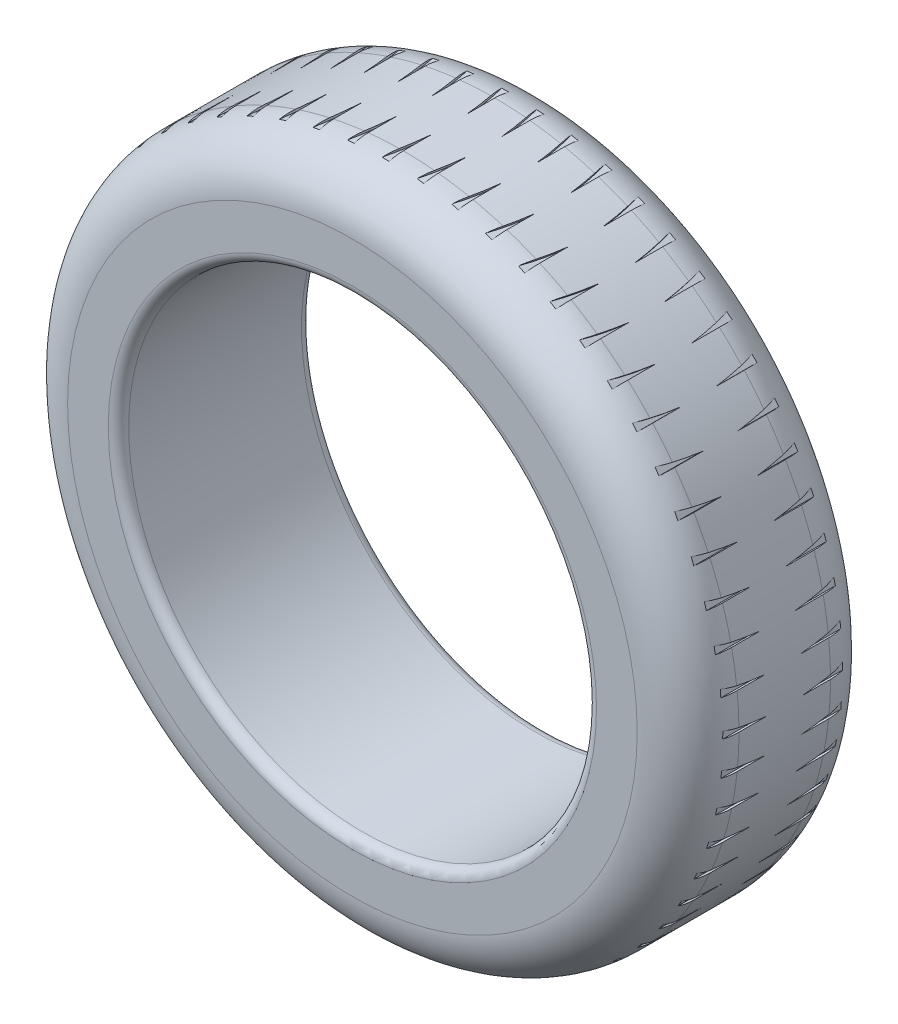
from build123d import *

# Parameters (mm, degrees)
SKETCH1_R             = 330
SKETCH1_R_2           = 230
BOSS_EXTRUDE1_DEPTH   = 190
FILLET4_R             = 50
CUT_EXTRUDE1_DEPTH    = 12
CIRPATTERN1_COUNT     = 60
MIRROR1_COPY_1_DEPTH  = 12
MIRROR1_COPY_2_DEPTH  = 12
MIRROR1_COPY_3_DEPTH  = 12
MIRROR1_COPY_4_DEPTH  = 12
MIRROR1_COPY_5_DEPTH  = 12
MIRROR1_COPY_6_DEPTH  = 12
MIRROR1_COPY_7_DEPTH  = 12
MIRROR1_COPY_8_DEPTH  = 12
MIRROR1_COPY_9_DEPTH  = 12
MIRROR1_COPY_10_DEPTH = 12
MIRROR1_COPY_11_DEPTH = 12
MIRROR1_COPY_12_DEPTH = 12
MIRROR1_COPY_13_DEPTH = 12
MIRROR1_COPY_14_DEPTH = 12
MIRROR1_COPY_15_DEPTH = 12
MIRROR1_COPY_16_DEPTH = 12
MIRROR1_COPY_17_DEPTH = 12
MIRROR1_COPY_18_DEPTH = 12
MIRROR1_COPY_19_DEPTH = 12
MIRROR1_COPY_20_DEPTH = 12
MIRROR1_COPY_21_DEPTH = 12
MIRROR1_COPY_22_DEPTH = 12
MIRROR1_COPY_23_DEPTH = 12
MIRROR1_COPY_24_DEPTH = 12
MIRROR1_COPY_25_DEPTH = 12
MIRROR1_COPY_26_DEPTH = 12
MIRROR1_COPY_27_DEPTH = 12
MIRROR1_COPY_28_DEPTH = 12
MIRROR1_COPY_29_DEPTH = 12
MIRROR1_COPY_30_DEPTH = 12
MIRROR1_COPY_31_DEPTH = 12
MIRROR1_COPY_32_DEPTH = 12
MIRROR1_COPY_33_DEPTH = 12
MIRROR1_COPY_34_DEPTH = 12
MIRROR1_COPY_35_DEPTH = 12
MIRROR1_COPY_36_DEPTH = 12
MIRROR1_COPY_37_DEPTH = 12
MIRROR1_COPY_38_DEPTH = 12
MIRROR1_COPY_39_DEPTH = 12
MIRROR1_COPY_40_DEPTH = 12
MIRROR1_COPY_41_DEPTH = 12
MIRROR1_COPY_42_DEPTH = 12
MIRROR1_COPY_43_DEPTH = 12
MIRROR1_COPY_44_DEPTH = 12
MIRROR1_COPY_45_DEPTH = 12
MIRROR1_COPY_46_DEPTH = 12
MIRROR1_COPY_47_DEPTH = 12
MIRROR1_COPY_48_DEPTH = 12
MIRROR1_COPY_49_DEPTH = 12
MIRROR1_COPY_50_DEPTH = 12
MIRROR1_COPY_51_DEPTH = 12
MIRROR1_COPY_52_DEPTH = 12
MIRROR1_COPY_53_DEPTH = 12
MIRROR1_COPY_54_DEPTH = 12
MIRROR1_COPY_55_DEPTH = 12
MIRROR1_COPY_56_DEPTH = 12
MIRROR1_COPY_57_DEPTH = 12
MIRROR1_COPY_58_DEPTH = 12
MIRROR1_COPY_59_DEPTH = 12
MIRROR1_COPY_60_DEPTH = 12
FILLET5_R             = 10


with BuildPart() as part:
    # Sketch1 → Boss-Extrude1 (new body)
    with BuildSketch(Plane.XY):
        Circle(SKETCH1_R)
        Circle(SKETCH1_R_2, mode=Mode.SUBTRACT)
    extrude(amount=-BOSS_EXTRUDE1_DEPTH)

    # Fillet4
    fillet4_edges = [part.edges().sort_by_distance(p)[0] for p in [
        (-330, 0, -190),
        (-330, 0, 0),
    ]]
    fillet(fillet4_edges, radius=FILLET4_R)

    # Sketch2 → Cut-Extrude1 (cut)
    with BuildSketch(Plane(origin=(0, 340, 0), x_dir=(1, 0, 0), z_dir=(0, 1, 0))):
        with BuildLine():
            Line((0, 77.679953819), (0, 0))
            Line((0, 0), (-10, 0))
            Line((-10, 0), (-10, 25))
            add(Edge.make_bspline(
                [(0, 77.679953819), (-1.474003448, 64.192682688), (-3.599070113, 46.669220615), (-10, 25)],
                knots=[0, 0, 0, 0, 1, 1, 1, 1], degree=3))
        make_face()
    cut_extrude1 = extrude(amount=-CUT_EXTRUDE1_DEPTH, mode=Mode.SUBTRACT)

    # CirPattern1: Cut-Extrude1 ×60 about axis
    cirpattern1_axis = Axis((0, 0, 0), (0, 0, 1))
    for i in range(1, CIRPATTERN1_COUNT):
        add(cut_extrude1.rotate(cirpattern1_axis, i * 360 / CIRPATTERN1_COUNT), mode=Mode.SUBTRACT)

    # Mirror1 copy 1 sketch → Mirror1 copy 1 (cut)
    with BuildSketch(Plane(origin=(-35.539677511, 338.137444425, -190), x_dir=(0.9945218953682733, 0.10452846326765347, 0), z_dir=(-0.10452846326765347, 0.9945218953682733, 0))):
        with BuildLine():
            Line((0, -77.679953819), (0, 0))
            Line((0, 0), (-10, 0))
            Line((-10, 0), (-10, -25))
            add(Edge.make_bspline(
                [(0, -77.679953819), (-1.474003448, -64.192682688), (-3.599070113, -46.669220615), (-10, -25)],
                knots=[0, 0, 0, 0, 1, 1, 1, 1], degree=3))
        make_face()
    extrude(amount=-MIRROR1_COPY_1_DEPTH, mode=Mode.SUBTRACT)

    # Mirror1 copy 2 sketch → Mirror1 copy 2 (cut)
    with BuildSketch(Plane(origin=(-70.689974878, 332.570184249, -190), x_dir=(0.9781476007338057, 0.20791169081775934, 0), z_dir=(-0.20791169081775934, 0.9781476007338057, 0))):
        with BuildLine():
            Line((0, -77.679953819), (0, 0))
            Line((0, 0), (-10, 0))
            Line((-10, 0), (-10, -25))
            add(Edge.make_bspline(
                [(0, -77.679953819), (-1.474003448, -64.192682688), (-3.599070113, -46.669220615), (-10, -25)],
                knots=[0, 0, 0, 0, 1, 1, 1, 1], degree=3))
        make_face()
    extrude(amount=-MIRROR1_COPY_2_DEPTH, mode=Mode.SUBTRACT)

    # Mirror1 copy 3 sketch → Mirror1 copy 3 (cut)
    with BuildSketch(Plane(origin=(-105.065778087, 323.35921554, -190), x_dir=(0.9510565162951535, 0.3090169943749474, 0), z_dir=(-0.3090169943749474, 0.9510565162951535, 0))):
        with BuildLine():
            Line((0, -77.679953819), (0, 0))
            Line((0, 0), (-10, 0))
            Line((-10, 0), (-10, -25))
            add(Edge.make_bspline(
                [(0, -77.679953819), (-1.474003448, -64.192682688), (-3.599070113, -46.669220615), (-10, -25)],
                knots=[0, 0, 0, 0, 1, 1, 1, 1], degree=3))
        make_face()
    extrude(amount=-MIRROR1_COPY_3_DEPTH, mode=Mode.SUBTRACT)

    # Mirror1 copy 4 sketch → Mirror1 copy 4 (cut)
    with BuildSketch(Plane(origin=(-138.290458646, 310.605455598, -190), x_dir=(0.9135454576426009, 0.4067366430758002, 0), z_dir=(-0.4067366430758002, 0.9135454576426009, 0))):
        with BuildLine():
            Line((0, -77.679953819), (0, 0))
            Line((0, 0), (-10, 0))
            Line((-10, 0), (-10, -25))
            add(Edge.make_bspline(
                [(0, -77.679953819), (-1.474003448, -64.192682688), (-3.599070113, -46.669220615), (-10, -25)],
                knots=[0, 0, 0, 0, 1, 1, 1, 1], degree=3))
        make_face()
    extrude(amount=-MIRROR1_COPY_4_DEPTH, mode=Mode.SUBTRACT)

    # Mirror1 copy 5 sketch → Mirror1 copy 5 (cut)
    with BuildSketch(Plane(origin=(-170, 294.448637287, -190), x_dir=(0.8660254037844387, 0.49999999999999994, 0), z_dir=(-0.49999999999999994, 0.8660254037844387, 0))):
        with BuildLine():
            Line((0, -77.679953819), (0, 0))
            Line((0, 0), (-10, 0))
            Line((-10, 0), (-10, -25))
            add(Edge.make_bspline(
                [(0, -77.679953819), (-1.474003448, -64.192682688), (-3.599070113, -46.669220615), (-10, -25)],
                knots=[0, 0, 0, 0, 1, 1, 1, 1], degree=3))
        make_face()
    extrude(amount=-MIRROR1_COPY_5_DEPTH, mode=Mode.SUBTRACT)

    # Mirror1 copy 6 sketch → Mirror1 copy 6 (cut)
    with BuildSketch(Plane(origin=(-199.846985779, 275.065778087, -190), x_dir=(0.8090169943749475, 0.5877852522924731, 0), z_dir=(-0.5877852522924731, 0.8090169943749475, 0))):
        with BuildLine():
            Line((0, -77.679953819), (0, 0))
            Line((0, 0), (-10, 0))
            Line((-10, 0), (-10, -25))
            add(Edge.make_bspline(
                [(0, -77.679953819), (-1.474003448, -64.192682688), (-3.599070113, -46.669220615), (-10, -25)],
                knots=[0, 0, 0, 0, 1, 1, 1, 1], degree=3))
        make_face()
    extrude(amount=-MIRROR1_COPY_6_DEPTH, mode=Mode.SUBTRACT)

    # Mirror1 copy 7 sketch → Mirror1 copy 7 (cut)
    with BuildSketch(Plane(origin=(-227.504406162, 252.669240662, -190), x_dir=(0.7431448254773942, 0.6691306063588582, 0), z_dir=(-0.6691306063588582, 0.7431448254773942, 0))):
        with BuildLine():
            Line((0, -77.679953819), (0, 0))
            Line((0, 0), (-10, 0))
            Line((-10, 0), (-10, -25))
            add(Edge.make_bspline(
                [(0, -77.679953819), (-1.474003448, -64.192682688), (-3.599070113, -46.669220615), (-10, -25)],
                knots=[0, 0, 0, 0, 1, 1, 1, 1], degree=3))
        make_face()
    extrude(amount=-MIRROR1_COPY_7_DEPTH, mode=Mode.SUBTRACT)

    # Mirror1 copy 8 sketch → Mirror1 copy 8 (cut)
    with BuildSketch(Plane(origin=(-252.669240662, 227.504406162, -190), x_dir=(0.6691306063588582, 0.7431448254773942, 0), z_dir=(-0.7431448254773942, 0.6691306063588582, 0))):
        with BuildLine():
            Line((0, -77.679953819), (0, 0))
            Line((0, 0), (-10, 0))
            Line((-10, 0), (-10, -25))
            add(Edge.make_bspline(
                [(0, -77.679953819), (-1.474003448, -64.192682688), (-3.599070113, -46.669220615), (-10, -25)],
                knots=[0, 0, 0, 0, 1, 1, 1, 1], degree=3))
        make_face()
    extrude(amount=-MIRROR1_COPY_8_DEPTH, mode=Mode.SUBTRACT)

    # Mirror1 copy 9 sketch → Mirror1 copy 9 (cut)
    with BuildSketch(Plane(origin=(-275.065778087, 199.846985779, -190), x_dir=(0.5877852522924731, 0.8090169943749475, 0), z_dir=(-0.8090169943749475, 0.5877852522924731, 0))):
        with BuildLine():
            Line((0, -77.679953819), (0, 0))
            Line((0, 0), (-10, 0))
            Line((-10, 0), (-10, -25))
            add(Edge.make_bspline(
                [(0, -77.679953819), (-1.474003448, -64.192682688), (-3.599070113, -46.669220615), (-10, -25)],
                knots=[0, 0, 0, 0, 1, 1, 1, 1], degree=3))
        make_face()
    extrude(amount=-MIRROR1_COPY_9_DEPTH, mode=Mode.SUBTRACT)

    # Mirror1 copy 10 sketch → Mirror1 copy 10 (cut)
    with BuildSketch(Plane(origin=(-294.448637287, 170, -190), x_dir=(0.5000000000000001, 0.8660254037844386, 0), z_dir=(-0.8660254037844386, 0.5000000000000001, 0))):
        with BuildLine():
            Line((0, -77.679953819), (0, 0))
            Line((0, 0), (-10, 0))
            Line((-10, 0), (-10, -25))
            add(Edge.make_bspline(
                [(0, -77.679953819), (-1.474003448, -64.192682688), (-3.599070113, -46.669220615), (-10, -25)],
                knots=[0, 0, 0, 0, 1, 1, 1, 1], degree=3))
        make_face()
    extrude(amount=-MIRROR1_COPY_10_DEPTH, mode=Mode.SUBTRACT)

    # Mirror1 copy 11 sketch → Mirror1 copy 11 (cut)
    with BuildSketch(Plane(origin=(-310.605455598, 138.290458646, -190), x_dir=(0.4067366430758002, 0.9135454576426009, 0), z_dir=(-0.9135454576426009, 0.4067366430758002, 0))):
        with BuildLine():
            Line((0, -77.679953819), (0, 0))
            Line((0, 0), (-10, 0))
            Line((-10, 0), (-10, -25))
            add(Edge.make_bspline(
                [(0, -77.679953819), (-1.474003448, -64.192682688), (-3.599070113, -46.669220615), (-10, -25)],
                knots=[0, 0, 0, 0, 1, 1, 1, 1], degree=3))
        make_face()
    extrude(amount=-MIRROR1_COPY_11_DEPTH, mode=Mode.SUBTRACT)

    # Mirror1 copy 12 sketch → Mirror1 copy 12 (cut)
    with BuildSketch(Plane(origin=(-323.35921554, 105.065778087, -190), x_dir=(0.30901699437494745, 0.9510565162951535, 0), z_dir=(-0.9510565162951535, 0.30901699437494745, 0))):
        with BuildLine():
            Line((0, -77.679953819), (0, 0))
            Line((0, 0), (-10, 0))
            Line((-10, 0), (-10, -25))
            add(Edge.make_bspline(
                [(0, -77.679953819), (-1.474003448, -64.192682688), (-3.599070113, -46.669220615), (-10, -25)],
                knots=[0, 0, 0, 0, 1, 1, 1, 1], degree=3))
        make_face()
    extrude(amount=-MIRROR1_COPY_12_DEPTH, mode=Mode.SUBTRACT)

    # Mirror1 copy 13 sketch → Mirror1 copy 13 (cut)
    with BuildSketch(Plane(origin=(-332.570184249, 70.689974878, -190), x_dir=(0.20791169081775945, 0.9781476007338056, 0), z_dir=(-0.9781476007338056, 0.20791169081775945, 0))):
        with BuildLine():
            Line((0, -77.679953819), (0, 0))
            Line((0, 0), (-10, 0))
            Line((-10, 0), (-10, -25))
            add(Edge.make_bspline(
                [(0, -77.679953819), (-1.474003448, -64.192682688), (-3.599070113, -46.669220615), (-10, -25)],
                knots=[0, 0, 0, 0, 1, 1, 1, 1], degree=3))
        make_face()
    extrude(amount=-MIRROR1_COPY_13_DEPTH, mode=Mode.SUBTRACT)

    # Mirror1 copy 14 sketch → Mirror1 copy 14 (cut)
    with BuildSketch(Plane(origin=(-338.137444425, 35.539677511, -190), x_dir=(0.10452846326765346, 0.9945218953682733, 0), z_dir=(-0.9945218953682733, 0.10452846326765346, 0))):
        with BuildLine():
            Line((0, -77.679953819), (0, 0))
            Line((0, 0), (-10, 0))
            Line((-10, 0), (-10, -25))
            add(Edge.make_bspline(
                [(0, -77.679953819), (-1.474003448, -64.192682688), (-3.599070113, -46.669220615), (-10, -25)],
                knots=[0, 0, 0, 0, 1, 1, 1, 1], degree=3))
        make_face()
    extrude(amount=-MIRROR1_COPY_14_DEPTH, mode=Mode.SUBTRACT)

    # Mirror1 copy 15 sketch → Mirror1 copy 15 (cut)
    with BuildSketch(Plane(origin=(-340, 0, -190), x_dir=(0, 1, 0), z_dir=(-1, 0, 0))):
        with BuildLine():
            Line((0, -77.679953819), (0, 0))
            Line((0, 0), (-10, 0))
            Line((-10, 0), (-10, -25))
            add(Edge.make_bspline(
                [(0, -77.679953819), (-1.474003448, -64.192682688), (-3.599070113, -46.669220615), (-10, -25)],
                knots=[0, 0, 0, 0, 1, 1, 1, 1], degree=3))
        make_face()
    extrude(amount=-MIRROR1_COPY_15_DEPTH, mode=Mode.SUBTRACT)

    # Mirror1 copy 16 sketch → Mirror1 copy 16 (cut)
    with BuildSketch(Plane(origin=(-338.137444425, -35.539677511, -190), x_dir=(-0.10452846326765355, 0.9945218953682733, 0), z_dir=(-0.9945218953682733, -0.10452846326765355, 0))):
        with BuildLine():
            Line((0, -77.679953819), (0, 0))
            Line((0, 0), (-10, 0))
            Line((-10, 0), (-10, -25))
            add(Edge.make_bspline(
                [(0, -77.679953819), (-1.474003448, -64.192682688), (-3.599070113, -46.669220615), (-10, -25)],
                knots=[0, 0, 0, 0, 1, 1, 1, 1], degree=3))
        make_face()
    extrude(amount=-MIRROR1_COPY_16_DEPTH, mode=Mode.SUBTRACT)

    # Mirror1 copy 17 sketch → Mirror1 copy 17 (cut)
    with BuildSketch(Plane(origin=(-332.570184249, -70.689974878, -190), x_dir=(-0.20791169081775934, 0.9781476007338057, 0), z_dir=(-0.9781476007338057, -0.20791169081775934, 0))):
        with BuildLine():
            Line((0, -77.679953819), (0, 0))
            Line((0, 0), (-10, 0))
            Line((-10, 0), (-10, -25))
            add(Edge.make_bspline(
                [(0, -77.679953819), (-1.474003448, -64.192682688), (-3.599070113, -46.669220615), (-10, -25)],
                knots=[0, 0, 0, 0, 1, 1, 1, 1], degree=3))
        make_face()
    extrude(amount=-MIRROR1_COPY_17_DEPTH, mode=Mode.SUBTRACT)

    # Mirror1 copy 18 sketch → Mirror1 copy 18 (cut)
    with BuildSketch(Plane(origin=(-323.35921554, -105.065778087, -190), x_dir=(-0.30901699437494734, 0.9510565162951536, 0), z_dir=(-0.9510565162951536, -0.30901699437494734, 0))):
        with BuildLine():
            Line((0, -77.679953819), (0, 0))
            Line((0, 0), (-10, 0))
            Line((-10, 0), (-10, -25))
            add(Edge.make_bspline(
                [(0, -77.679953819), (-1.474003448, -64.192682688), (-3.599070113, -46.669220615), (-10, -25)],
                knots=[0, 0, 0, 0, 1, 1, 1, 1], degree=3))
        make_face()
    extrude(amount=-MIRROR1_COPY_18_DEPTH, mode=Mode.SUBTRACT)

    # Mirror1 copy 19 sketch → Mirror1 copy 19 (cut)
    with BuildSketch(Plane(origin=(-310.605455598, -138.290458646, -190), x_dir=(-0.40673664307580026, 0.9135454576426009, 0), z_dir=(-0.9135454576426009, -0.40673664307580026, 0))):
        with BuildLine():
            Line((0, -77.679953819), (0, 0))
            Line((0, 0), (-10, 0))
            Line((-10, 0), (-10, -25))
            add(Edge.make_bspline(
                [(0, -77.679953819), (-1.474003448, -64.192682688), (-3.599070113, -46.669220615), (-10, -25)],
                knots=[0, 0, 0, 0, 1, 1, 1, 1], degree=3))
        make_face()
    extrude(amount=-MIRROR1_COPY_19_DEPTH, mode=Mode.SUBTRACT)

    # Mirror1 copy 20 sketch → Mirror1 copy 20 (cut)
    with BuildSketch(Plane(origin=(-294.448637287, -170, -190), x_dir=(-0.4999999999999998, 0.8660254037844387, 0), z_dir=(-0.8660254037844387, -0.4999999999999998, 0))):
        with BuildLine():
            Line((0, -77.679953819), (0, 0))
            Line((0, 0), (-10, 0))
            Line((-10, 0), (-10, -25))
            add(Edge.make_bspline(
                [(0, -77.679953819), (-1.474003448, -64.192682688), (-3.599070113, -46.669220615), (-10, -25)],
                knots=[0, 0, 0, 0, 1, 1, 1, 1], degree=3))
        make_face()
    extrude(amount=-MIRROR1_COPY_20_DEPTH, mode=Mode.SUBTRACT)

    # Mirror1 copy 21 sketch → Mirror1 copy 21 (cut)
    with BuildSketch(Plane(origin=(-275.065778087, -199.846985779, -190), x_dir=(-0.587785252292473, 0.8090169943749475, 0), z_dir=(-0.8090169943749475, -0.587785252292473, 0))):
        with BuildLine():
            Line((0, -77.679953819), (0, 0))
            Line((0, 0), (-10, 0))
            Line((-10, 0), (-10, -25))
            add(Edge.make_bspline(
                [(0, -77.679953819), (-1.474003448, -64.192682688), (-3.599070113, -46.669220615), (-10, -25)],
                knots=[0, 0, 0, 0, 1, 1, 1, 1], degree=3))
        make_face()
    extrude(amount=-MIRROR1_COPY_21_DEPTH, mode=Mode.SUBTRACT)

    # Mirror1 copy 22 sketch → Mirror1 copy 22 (cut)
    with BuildSketch(Plane(origin=(-252.669240662, -227.504406162, -190), x_dir=(-0.6691306063588582, 0.7431448254773942, 0), z_dir=(-0.7431448254773942, -0.6691306063588582, 0))):
        with BuildLine():
            Line((0, -77.679953819), (0, 0))
            Line((0, 0), (-10, 0))
            Line((-10, 0), (-10, -25))
            add(Edge.make_bspline(
                [(0, -77.679953819), (-1.474003448, -64.192682688), (-3.599070113, -46.669220615), (-10, -25)],
                knots=[0, 0, 0, 0, 1, 1, 1, 1], degree=3))
        make_face()
    extrude(amount=-MIRROR1_COPY_22_DEPTH, mode=Mode.SUBTRACT)

    # Mirror1 copy 23 sketch → Mirror1 copy 23 (cut)
    with BuildSketch(Plane(origin=(-227.504406162, -252.669240662, -190), x_dir=(-0.743144825477394, 0.6691306063588583, 0), z_dir=(-0.6691306063588583, -0.743144825477394, 0))):
        with BuildLine():
            Line((0, -77.679953819), (0, 0))
            Line((0, 0), (-10, 0))
            Line((-10, 0), (-10, -25))
            add(Edge.make_bspline(
                [(0, -77.679953819), (-1.474003448, -64.192682688), (-3.599070113, -46.669220615), (-10, -25)],
                knots=[0, 0, 0, 0, 1, 1, 1, 1], degree=3))
        make_face()
    extrude(amount=-MIRROR1_COPY_23_DEPTH, mode=Mode.SUBTRACT)

    # Mirror1 copy 24 sketch → Mirror1 copy 24 (cut)
    with BuildSketch(Plane(origin=(-199.846985779, -275.065778087, -190), x_dir=(-0.8090169943749473, 0.5877852522924732, 0), z_dir=(-0.5877852522924732, -0.8090169943749473, 0))):
        with BuildLine():
            Line((0, -77.679953819), (0, 0))
            Line((0, 0), (-10, 0))
            Line((-10, 0), (-10, -25))
            add(Edge.make_bspline(
                [(0, -77.679953819), (-1.474003448, -64.192682688), (-3.599070113, -46.669220615), (-10, -25)],
                knots=[0, 0, 0, 0, 1, 1, 1, 1], degree=3))
        make_face()
    extrude(amount=-MIRROR1_COPY_24_DEPTH, mode=Mode.SUBTRACT)

    # Mirror1 copy 25 sketch → Mirror1 copy 25 (cut)
    with BuildSketch(Plane(origin=(-170, -294.448637287, -190), x_dir=(-0.8660254037844387, 0.49999999999999994, 0), z_dir=(-0.49999999999999994, -0.8660254037844387, 0))):
        with BuildLine():
            Line((0, -77.679953819), (0, 0))
            Line((0, 0), (-10, 0))
            Line((-10, 0), (-10, -25))
            add(Edge.make_bspline(
                [(0, -77.679953819), (-1.474003448, -64.192682688), (-3.599070113, -46.669220615), (-10, -25)],
                knots=[0, 0, 0, 0, 1, 1, 1, 1], degree=3))
        make_face()
    extrude(amount=-MIRROR1_COPY_25_DEPTH, mode=Mode.SUBTRACT)

    # Mirror1 copy 26 sketch → Mirror1 copy 26 (cut)
    with BuildSketch(Plane(origin=(-138.290458646, -310.605455598, -190), x_dir=(-0.9135454576426008, 0.40673664307580043, 0), z_dir=(-0.40673664307580043, -0.9135454576426008, 0))):
        with BuildLine():
            Line((0, -77.679953819), (0, 0))
            Line((0, 0), (-10, 0))
            Line((-10, 0), (-10, -25))
            add(Edge.make_bspline(
                [(0, -77.679953819), (-1.474003448, -64.192682688), (-3.599070113, -46.669220615), (-10, -25)],
                knots=[0, 0, 0, 0, 1, 1, 1, 1], degree=3))
        make_face()
    extrude(amount=-MIRROR1_COPY_26_DEPTH, mode=Mode.SUBTRACT)

    # Mirror1 copy 27 sketch → Mirror1 copy 27 (cut)
    with BuildSketch(Plane(origin=(-105.065778087, -323.35921554, -190), x_dir=(-0.9510565162951535, 0.3090169943749475, 0), z_dir=(-0.3090169943749475, -0.9510565162951535, 0))):
        with BuildLine():
            Line((0, -77.679953819), (0, 0))
            Line((0, 0), (-10, 0))
            Line((-10, 0), (-10, -25))
            add(Edge.make_bspline(
                [(0, -77.679953819), (-1.474003448, -64.192682688), (-3.599070113, -46.669220615), (-10, -25)],
                knots=[0, 0, 0, 0, 1, 1, 1, 1], degree=3))
        make_face()
    extrude(amount=-MIRROR1_COPY_27_DEPTH, mode=Mode.SUBTRACT)

    # Mirror1 copy 28 sketch → Mirror1 copy 28 (cut)
    with BuildSketch(Plane(origin=(-70.689974878, -332.570184249, -190), x_dir=(-0.9781476007338057, 0.20791169081775931, 0), z_dir=(-0.20791169081775931, -0.9781476007338057, 0))):
        with BuildLine():
            Line((0, -77.679953819), (0, 0))
            Line((0, 0), (-10, 0))
            Line((-10, 0), (-10, -25))
            add(Edge.make_bspline(
                [(0, -77.679953819), (-1.474003448, -64.192682688), (-3.599070113, -46.669220615), (-10, -25)],
                knots=[0, 0, 0, 0, 1, 1, 1, 1], degree=3))
        make_face()
    extrude(amount=-MIRROR1_COPY_28_DEPTH, mode=Mode.SUBTRACT)

    # Mirror1 copy 29 sketch → Mirror1 copy 29 (cut)
    with BuildSketch(Plane(origin=(-35.539677511, -338.137444425, -190), x_dir=(-0.9945218953682733, 0.10452846326765373, 0), z_dir=(-0.10452846326765373, -0.9945218953682733, 0))):
        with BuildLine():
            Line((0, -77.679953819), (0, 0))
            Line((0, 0), (-10, 0))
            Line((-10, 0), (-10, -25))
            add(Edge.make_bspline(
                [(0, -77.679953819), (-1.474003448, -64.192682688), (-3.599070113, -46.669220615), (-10, -25)],
                knots=[0, 0, 0, 0, 1, 1, 1, 1], degree=3))
        make_face()
    extrude(amount=-MIRROR1_COPY_29_DEPTH, mode=Mode.SUBTRACT)

    # Mirror1 copy 30 sketch → Mirror1 copy 30 (cut)
    with BuildSketch(Plane(origin=(0, -340, -190), x_dir=(-1, 0, 0), z_dir=(0, -1, 0))):
        with BuildLine():
            Line((0, -77.679953819), (0, 0))
            Line((0, 0), (-10, 0))
            Line((-10, 0), (-10, -25))
            add(Edge.make_bspline(
                [(0, -77.679953819), (-1.474003448, -64.192682688), (-3.599070113, -46.669220615), (-10, -25)],
                knots=[0, 0, 0, 0, 1, 1, 1, 1], degree=3))
        make_face()
    extrude(amount=-MIRROR1_COPY_30_DEPTH, mode=Mode.SUBTRACT)

    # Mirror1 copy 31 sketch → Mirror1 copy 31 (cut)
    with BuildSketch(Plane(origin=(35.539677511, -338.137444425, -190), x_dir=(-0.9945218953682733, -0.1045284632676535, 0), z_dir=(0.1045284632676535, -0.9945218953682733, 0))):
        with BuildLine():
            Line((0, -77.679953819), (0, 0))
            Line((0, 0), (-10, 0))
            Line((-10, 0), (-10, -25))
            add(Edge.make_bspline(
                [(0, -77.679953819), (-1.474003448, -64.192682688), (-3.599070113, -46.669220615), (-10, -25)],
                knots=[0, 0, 0, 0, 1, 1, 1, 1], degree=3))
        make_face()
    extrude(amount=-MIRROR1_COPY_31_DEPTH, mode=Mode.SUBTRACT)

    # Mirror1 copy 32 sketch → Mirror1 copy 32 (cut)
    with BuildSketch(Plane(origin=(70.689974878, -332.570184249, -190), x_dir=(-0.9781476007338056, -0.2079116908177595, 0), z_dir=(0.2079116908177595, -0.9781476007338056, 0))):
        with BuildLine():
            Line((0, -77.679953819), (0, 0))
            Line((0, 0), (-10, 0))
            Line((-10, 0), (-10, -25))
            add(Edge.make_bspline(
                [(0, -77.679953819), (-1.474003448, -64.192682688), (-3.599070113, -46.669220615), (-10, -25)],
                knots=[0, 0, 0, 0, 1, 1, 1, 1], degree=3))
        make_face()
    extrude(amount=-MIRROR1_COPY_32_DEPTH, mode=Mode.SUBTRACT)

    # Mirror1 copy 33 sketch → Mirror1 copy 33 (cut)
    with BuildSketch(Plane(origin=(105.065778087, -323.35921554, -190), x_dir=(-0.9510565162951536, -0.3090169943749473, 0), z_dir=(0.3090169943749473, -0.9510565162951536, 0))):
        with BuildLine():
            Line((0, -77.679953819), (0, 0))
            Line((0, 0), (-10, 0))
            Line((-10, 0), (-10, -25))
            add(Edge.make_bspline(
                [(0, -77.679953819), (-1.474003448, -64.192682688), (-3.599070113, -46.669220615), (-10, -25)],
                knots=[0, 0, 0, 0, 1, 1, 1, 1], degree=3))
        make_face()
    extrude(amount=-MIRROR1_COPY_33_DEPTH, mode=Mode.SUBTRACT)

    # Mirror1 copy 34 sketch → Mirror1 copy 34 (cut)
    with BuildSketch(Plane(origin=(138.290458646, -310.605455598, -190), x_dir=(-0.9135454576426009, -0.4067366430758002, 0), z_dir=(0.4067366430758002, -0.9135454576426009, 0))):
        with BuildLine():
            Line((0, -77.679953819), (0, 0))
            Line((0, 0), (-10, 0))
            Line((-10, 0), (-10, -25))
            add(Edge.make_bspline(
                [(0, -77.679953819), (-1.474003448, -64.192682688), (-3.599070113, -46.669220615), (-10, -25)],
                knots=[0, 0, 0, 0, 1, 1, 1, 1], degree=3))
        make_face()
    extrude(amount=-MIRROR1_COPY_34_DEPTH, mode=Mode.SUBTRACT)

    # Mirror1 copy 35 sketch → Mirror1 copy 35 (cut)
    with BuildSketch(Plane(origin=(170, -294.448637287, -190), x_dir=(-0.8660254037844386, -0.5000000000000001, 0), z_dir=(0.5000000000000001, -0.8660254037844386, 0))):
        with BuildLine():
            Line((0, -77.679953819), (0, 0))
            Line((0, 0), (-10, 0))
            Line((-10, 0), (-10, -25))
            add(Edge.make_bspline(
                [(0, -77.679953819), (-1.474003448, -64.192682688), (-3.599070113, -46.669220615), (-10, -25)],
                knots=[0, 0, 0, 0, 1, 1, 1, 1], degree=3))
        make_face()
    extrude(amount=-MIRROR1_COPY_35_DEPTH, mode=Mode.SUBTRACT)

    # Mirror1 copy 36 sketch → Mirror1 copy 36 (cut)
    with BuildSketch(Plane(origin=(199.846985779, -275.065778087, -190), x_dir=(-0.8090169943749476, -0.587785252292473, 0), z_dir=(0.587785252292473, -0.8090169943749476, 0))):
        with BuildLine():
            Line((0, -77.679953819), (0, 0))
            Line((0, 0), (-10, 0))
            Line((-10, 0), (-10, -25))
            add(Edge.make_bspline(
                [(0, -77.679953819), (-1.474003448, -64.192682688), (-3.599070113, -46.669220615), (-10, -25)],
                knots=[0, 0, 0, 0, 1, 1, 1, 1], degree=3))
        make_face()
    extrude(amount=-MIRROR1_COPY_36_DEPTH, mode=Mode.SUBTRACT)

    # Mirror1 copy 37 sketch → Mirror1 copy 37 (cut)
    with BuildSketch(Plane(origin=(227.504406162, -252.669240662, -190), x_dir=(-0.7431448254773942, -0.6691306063588582, 0), z_dir=(0.6691306063588582, -0.7431448254773942, 0))):
        with BuildLine():
            Line((0, -77.679953819), (0, 0))
            Line((0, 0), (-10, 0))
            Line((-10, 0), (-10, -25))
            add(Edge.make_bspline(
                [(0, -77.679953819), (-1.474003448, -64.192682688), (-3.599070113, -46.669220615), (-10, -25)],
                knots=[0, 0, 0, 0, 1, 1, 1, 1], degree=3))
        make_face()
    extrude(amount=-MIRROR1_COPY_37_DEPTH, mode=Mode.SUBTRACT)

    # Mirror1 copy 38 sketch → Mirror1 copy 38 (cut)
    with BuildSketch(Plane(origin=(252.669240662, -227.504406162, -190), x_dir=(-0.6691306063588581, -0.7431448254773944, 0), z_dir=(0.7431448254773944, -0.6691306063588581, 0))):
        with BuildLine():
            Line((0, -77.679953819), (0, 0))
            Line((0, 0), (-10, 0))
            Line((-10, 0), (-10, -25))
            add(Edge.make_bspline(
                [(0, -77.679953819), (-1.474003448, -64.192682688), (-3.599070113, -46.669220615), (-10, -25)],
                knots=[0, 0, 0, 0, 1, 1, 1, 1], degree=3))
        make_face()
    extrude(amount=-MIRROR1_COPY_38_DEPTH, mode=Mode.SUBTRACT)

    # Mirror1 copy 39 sketch → Mirror1 copy 39 (cut)
    with BuildSketch(Plane(origin=(275.065778087, -199.846985779, -190), x_dir=(-0.5877852522924732, -0.8090169943749473, 0), z_dir=(0.8090169943749473, -0.5877852522924732, 0))):
        with BuildLine():
            Line((0, -77.679953819), (0, 0))
            Line((0, 0), (-10, 0))
            Line((-10, 0), (-10, -25))
            add(Edge.make_bspline(
                [(0, -77.679953819), (-1.474003448, -64.192682688), (-3.599070113, -46.669220615), (-10, -25)],
                knots=[0, 0, 0, 0, 1, 1, 1, 1], degree=3))
        make_face()
    extrude(amount=-MIRROR1_COPY_39_DEPTH, mode=Mode.SUBTRACT)

    # Mirror1 copy 40 sketch → Mirror1 copy 40 (cut)
    with BuildSketch(Plane(origin=(294.448637287, -170, -190), x_dir=(-0.5000000000000004, -0.8660254037844384, 0), z_dir=(0.8660254037844384, -0.5000000000000004, 0))):
        with BuildLine():
            Line((0, -77.679953819), (0, 0))
            Line((0, 0), (-10, 0))
            Line((-10, 0), (-10, -25))
            add(Edge.make_bspline(
                [(0, -77.679953819), (-1.474003448, -64.192682688), (-3.599070113, -46.669220615), (-10, -25)],
                knots=[0, 0, 0, 0, 1, 1, 1, 1], degree=3))
        make_face()
    extrude(amount=-MIRROR1_COPY_40_DEPTH, mode=Mode.SUBTRACT)

    # Mirror1 copy 41 sketch → Mirror1 copy 41 (cut)
    with BuildSketch(Plane(origin=(310.605455598, -138.290458646, -190), x_dir=(-0.4067366430758001, -0.913545457642601, 0), z_dir=(0.913545457642601, -0.4067366430758001, 0))):
        with BuildLine():
            Line((0, -77.679953819), (0, 0))
            Line((0, 0), (-10, 0))
            Line((-10, 0), (-10, -25))
            add(Edge.make_bspline(
                [(0, -77.679953819), (-1.474003448, -64.192682688), (-3.599070113, -46.669220615), (-10, -25)],
                knots=[0, 0, 0, 0, 1, 1, 1, 1], degree=3))
        make_face()
    extrude(amount=-MIRROR1_COPY_41_DEPTH, mode=Mode.SUBTRACT)

    # Mirror1 copy 42 sketch → Mirror1 copy 42 (cut)
    with BuildSketch(Plane(origin=(323.35921554, -105.065778087, -190), x_dir=(-0.30901699437494756, -0.9510565162951535, 0), z_dir=(0.9510565162951535, -0.30901699437494756, 0))):
        with BuildLine():
            Line((0, -77.679953819), (0, 0))
            Line((0, 0), (-10, 0))
            Line((-10, 0), (-10, -25))
            add(Edge.make_bspline(
                [(0, -77.679953819), (-1.474003448, -64.192682688), (-3.599070113, -46.669220615), (-10, -25)],
                knots=[0, 0, 0, 0, 1, 1, 1, 1], degree=3))
        make_face()
    extrude(amount=-MIRROR1_COPY_42_DEPTH, mode=Mode.SUBTRACT)

    # Mirror1 copy 43 sketch → Mirror1 copy 43 (cut)
    with BuildSketch(Plane(origin=(332.570184249, -70.689974878, -190), x_dir=(-0.2079116908177598, -0.9781476007338056, 0), z_dir=(0.9781476007338056, -0.2079116908177598, 0))):
        with BuildLine():
            Line((0, -77.679953819), (0, 0))
            Line((0, 0), (-10, 0))
            Line((-10, 0), (-10, -25))
            add(Edge.make_bspline(
                [(0, -77.679953819), (-1.474003448, -64.192682688), (-3.599070113, -46.669220615), (-10, -25)],
                knots=[0, 0, 0, 0, 1, 1, 1, 1], degree=3))
        make_face()
    extrude(amount=-MIRROR1_COPY_43_DEPTH, mode=Mode.SUBTRACT)

    # Mirror1 copy 44 sketch → Mirror1 copy 44 (cut)
    with BuildSketch(Plane(origin=(338.137444425, -35.539677511, -190), x_dir=(-0.10452846326765336, -0.9945218953682734, 0), z_dir=(0.9945218953682734, -0.10452846326765336, 0))):
        with BuildLine():
            Line((0, -77.679953819), (0, 0))
            Line((0, 0), (-10, 0))
            Line((-10, 0), (-10, -25))
            add(Edge.make_bspline(
                [(0, -77.679953819), (-1.474003448, -64.192682688), (-3.599070113, -46.669220615), (-10, -25)],
                knots=[0, 0, 0, 0, 1, 1, 1, 1], degree=3))
        make_face()
    extrude(amount=-MIRROR1_COPY_44_DEPTH, mode=Mode.SUBTRACT)

    # Mirror1 copy 45 sketch → Mirror1 copy 45 (cut)
    with BuildSketch(Plane(origin=(340, 0, -190), x_dir=(0, -1, 0), z_dir=(1, 0, 0))):
        with BuildLine():
            Line((0, -77.679953819), (0, 0))
            Line((0, 0), (-10, 0))
            Line((-10, 0), (-10, -25))
            add(Edge.make_bspline(
                [(0, -77.679953819), (-1.474003448, -64.192682688), (-3.599070113, -46.669220615), (-10, -25)],
                knots=[0, 0, 0, 0, 1, 1, 1, 1], degree=3))
        make_face()
    extrude(amount=-MIRROR1_COPY_45_DEPTH, mode=Mode.SUBTRACT)

    # Mirror1 copy 46 sketch → Mirror1 copy 46 (cut)
    with BuildSketch(Plane(origin=(338.137444425, 35.539677511, -190), x_dir=(0.10452846326765299, -0.9945218953682734, 0), z_dir=(0.9945218953682734, 0.10452846326765299, 0))):
        with BuildLine():
            Line((0, -77.679953819), (0, 0))
            Line((0, 0), (-10, 0))
            Line((-10, 0), (-10, -25))
            add(Edge.make_bspline(
                [(0, -77.679953819), (-1.474003448, -64.192682688), (-3.599070113, -46.669220615), (-10, -25)],
                knots=[0, 0, 0, 0, 1, 1, 1, 1], degree=3))
        make_face()
    extrude(amount=-MIRROR1_COPY_46_DEPTH, mode=Mode.SUBTRACT)

    # Mirror1 copy 47 sketch → Mirror1 copy 47 (cut)
    with BuildSketch(Plane(origin=(332.570184249, 70.689974878, -190), x_dir=(0.20791169081775943, -0.9781476007338056, 0), z_dir=(0.9781476007338056, 0.20791169081775943, 0))):
        with BuildLine():
            Line((0, -77.679953819), (0, 0))
            Line((0, 0), (-10, 0))
            Line((-10, 0), (-10, -25))
            add(Edge.make_bspline(
                [(0, -77.679953819), (-1.474003448, -64.192682688), (-3.599070113, -46.669220615), (-10, -25)],
                knots=[0, 0, 0, 0, 1, 1, 1, 1], degree=3))
        make_face()
    extrude(amount=-MIRROR1_COPY_47_DEPTH, mode=Mode.SUBTRACT)

    # Mirror1 copy 48 sketch → Mirror1 copy 48 (cut)
    with BuildSketch(Plane(origin=(323.35921554, 105.065778087, -190), x_dir=(0.30901699437494723, -0.9510565162951536, 0), z_dir=(0.9510565162951536, 0.30901699437494723, 0))):
        with BuildLine():
            Line((0, -77.679953819), (0, 0))
            Line((0, 0), (-10, 0))
            Line((-10, 0), (-10, -25))
            add(Edge.make_bspline(
                [(0, -77.679953819), (-1.474003448, -64.192682688), (-3.599070113, -46.669220615), (-10, -25)],
                knots=[0, 0, 0, 0, 1, 1, 1, 1], degree=3))
        make_face()
    extrude(amount=-MIRROR1_COPY_48_DEPTH, mode=Mode.SUBTRACT)

    # Mirror1 copy 49 sketch → Mirror1 copy 49 (cut)
    with BuildSketch(Plane(origin=(310.605455598, 138.290458646, -190), x_dir=(0.40673664307579976, -0.9135454576426011, 0), z_dir=(0.9135454576426011, 0.40673664307579976, 0))):
        with BuildLine():
            Line((0, -77.679953819), (0, 0))
            Line((0, 0), (-10, 0))
            Line((-10, 0), (-10, -25))
            add(Edge.make_bspline(
                [(0, -77.679953819), (-1.474003448, -64.192682688), (-3.599070113, -46.669220615), (-10, -25)],
                knots=[0, 0, 0, 0, 1, 1, 1, 1], degree=3))
        make_face()
    extrude(amount=-MIRROR1_COPY_49_DEPTH, mode=Mode.SUBTRACT)

    # Mirror1 copy 50 sketch → Mirror1 copy 50 (cut)
    with BuildSketch(Plane(origin=(294.448637287, 170, -190), x_dir=(0.5000000000000001, -0.8660254037844386, 0), z_dir=(0.8660254037844386, 0.5000000000000001, 0))):
        with BuildLine():
            Line((0, -77.679953819), (0, 0))
            Line((0, 0), (-10, 0))
            Line((-10, 0), (-10, -25))
            add(Edge.make_bspline(
                [(0, -77.679953819), (-1.474003448, -64.192682688), (-3.599070113, -46.669220615), (-10, -25)],
                knots=[0, 0, 0, 0, 1, 1, 1, 1], degree=3))
        make_face()
    extrude(amount=-MIRROR1_COPY_50_DEPTH, mode=Mode.SUBTRACT)

    # Mirror1 copy 51 sketch → Mirror1 copy 51 (cut)
    with BuildSketch(Plane(origin=(275.065778087, 199.846985779, -190), x_dir=(0.5877852522924729, -0.8090169943749476, 0), z_dir=(0.8090169943749476, 0.5877852522924729, 0))):
        with BuildLine():
            Line((0, -77.679953819), (0, 0))
            Line((0, 0), (-10, 0))
            Line((-10, 0), (-10, -25))
            add(Edge.make_bspline(
                [(0, -77.679953819), (-1.474003448, -64.192682688), (-3.599070113, -46.669220615), (-10, -25)],
                knots=[0, 0, 0, 0, 1, 1, 1, 1], degree=3))
        make_face()
    extrude(amount=-MIRROR1_COPY_51_DEPTH, mode=Mode.SUBTRACT)

    # Mirror1 copy 52 sketch → Mirror1 copy 52 (cut)
    with BuildSketch(Plane(origin=(252.669240662, 227.504406162, -190), x_dir=(0.6691306063588578, -0.7431448254773946, 0), z_dir=(0.7431448254773946, 0.6691306063588578, 0))):
        with BuildLine():
            Line((0, -77.679953819), (0, 0))
            Line((0, 0), (-10, 0))
            Line((-10, 0), (-10, -25))
            add(Edge.make_bspline(
                [(0, -77.679953819), (-1.474003448, -64.192682688), (-3.599070113, -46.669220615), (-10, -25)],
                knots=[0, 0, 0, 0, 1, 1, 1, 1], degree=3))
        make_face()
    extrude(amount=-MIRROR1_COPY_52_DEPTH, mode=Mode.SUBTRACT)

    # Mirror1 copy 53 sketch → Mirror1 copy 53 (cut)
    with BuildSketch(Plane(origin=(227.504406162, 252.669240662, -190), x_dir=(0.7431448254773942, -0.6691306063588581, 0), z_dir=(0.6691306063588581, 0.7431448254773942, 0))):
        with BuildLine():
            Line((0, -77.679953819), (0, 0))
            Line((0, 0), (-10, 0))
            Line((-10, 0), (-10, -25))
            add(Edge.make_bspline(
                [(0, -77.679953819), (-1.474003448, -64.192682688), (-3.599070113, -46.669220615), (-10, -25)],
                knots=[0, 0, 0, 0, 1, 1, 1, 1], degree=3))
        make_face()
    extrude(amount=-MIRROR1_COPY_53_DEPTH, mode=Mode.SUBTRACT)

    # Mirror1 copy 54 sketch → Mirror1 copy 54 (cut)
    with BuildSketch(Plane(origin=(199.846985779, 275.065778087, -190), x_dir=(0.8090169943749473, -0.5877852522924734, 0), z_dir=(0.5877852522924734, 0.8090169943749473, 0))):
        with BuildLine():
            Line((0, -77.679953819), (0, 0))
            Line((0, 0), (-10, 0))
            Line((-10, 0), (-10, -25))
            add(Edge.make_bspline(
                [(0, -77.679953819), (-1.474003448, -64.192682688), (-3.599070113, -46.669220615), (-10, -25)],
                knots=[0, 0, 0, 0, 1, 1, 1, 1], degree=3))
        make_face()
    extrude(amount=-MIRROR1_COPY_54_DEPTH, mode=Mode.SUBTRACT)

    # Mirror1 copy 55 sketch → Mirror1 copy 55 (cut)
    with BuildSketch(Plane(origin=(170, 294.448637287, -190), x_dir=(0.8660254037844384, -0.5000000000000004, 0), z_dir=(0.5000000000000004, 0.8660254037844384, 0))):
        with BuildLine():
            Line((0, -77.679953819), (0, 0))
            Line((0, 0), (-10, 0))
            Line((-10, 0), (-10, -25))
            add(Edge.make_bspline(
                [(0, -77.679953819), (-1.474003448, -64.192682688), (-3.599070113, -46.669220615), (-10, -25)],
                knots=[0, 0, 0, 0, 1, 1, 1, 1], degree=3))
        make_face()
    extrude(amount=-MIRROR1_COPY_55_DEPTH, mode=Mode.SUBTRACT)

    # Mirror1 copy 56 sketch → Mirror1 copy 56 (cut)
    with BuildSketch(Plane(origin=(138.290458646, 310.605455598, -190), x_dir=(0.913545457642601, -0.40673664307580015, 0), z_dir=(0.40673664307580015, 0.913545457642601, 0))):
        with BuildLine():
            Line((0, -77.679953819), (0, 0))
            Line((0, 0), (-10, 0))
            Line((-10, 0), (-10, -25))
            add(Edge.make_bspline(
                [(0, -77.679953819), (-1.474003448, -64.192682688), (-3.599070113, -46.669220615), (-10, -25)],
                knots=[0, 0, 0, 0, 1, 1, 1, 1], degree=3))
        make_face()
    extrude(amount=-MIRROR1_COPY_56_DEPTH, mode=Mode.SUBTRACT)

    # Mirror1 copy 57 sketch → Mirror1 copy 57 (cut)
    with BuildSketch(Plane(origin=(105.065778087, 323.35921554, -190), x_dir=(0.9510565162951535, -0.3090169943749476, 0), z_dir=(0.3090169943749476, 0.9510565162951535, 0))):
        with BuildLine():
            Line((0, -77.679953819), (0, 0))
            Line((0, 0), (-10, 0))
            Line((-10, 0), (-10, -25))
            add(Edge.make_bspline(
                [(0, -77.679953819), (-1.474003448, -64.192682688), (-3.599070113, -46.669220615), (-10, -25)],
                knots=[0, 0, 0, 0, 1, 1, 1, 1], degree=3))
        make_face()
    extrude(amount=-MIRROR1_COPY_57_DEPTH, mode=Mode.SUBTRACT)

    # Mirror1 copy 58 sketch → Mirror1 copy 58 (cut)
    with BuildSketch(Plane(origin=(70.689974878, 332.570184249, -190), x_dir=(0.9781476007338056, -0.20791169081775987, 0), z_dir=(0.20791169081775987, 0.9781476007338056, 0))):
        with BuildLine():
            Line((0, -77.679953819), (0, 0))
            Line((0, 0), (-10, 0))
            Line((-10, 0), (-10, -25))
            add(Edge.make_bspline(
                [(0, -77.679953819), (-1.474003448, -64.192682688), (-3.599070113, -46.669220615), (-10, -25)],
                knots=[0, 0, 0, 0, 1, 1, 1, 1], degree=3))
        make_face()
    extrude(amount=-MIRROR1_COPY_58_DEPTH, mode=Mode.SUBTRACT)

    # Mirror1 copy 59 sketch → Mirror1 copy 59 (cut)
    with BuildSketch(Plane(origin=(35.539677511, 338.137444425, -190), x_dir=(0.9945218953682733, -0.10452846326765342, 0), z_dir=(0.10452846326765342, 0.9945218953682733, 0))):
        with BuildLine():
            Line((0, -77.679953819), (0, 0))
            Line((0, 0), (-10, 0))
            Line((-10, 0), (-10, -25))
            add(Edge.make_bspline(
                [(0, -77.679953819), (-1.474003448, -64.192682688), (-3.599070113, -46.669220615), (-10, -25)],
                knots=[0, 0, 0, 0, 1, 1, 1, 1], degree=3))
        make_face()
    extrude(amount=-MIRROR1_COPY_59_DEPTH, mode=Mode.SUBTRACT)

    # Mirror1 copy 60 sketch → Mirror1 copy 60 (cut)
    with BuildSketch(Plane(origin=(0, 340, -190), x_dir=(1, 0, 0), z_dir=(0, 1, 0))):
        with BuildLine():
            Line((0, -77.679953819), (0, 0))
            Line((0, 0), (-10, 0))
            Line((-10, 0), (-10, -25))
            add(Edge.make_bspline(
                [(0, -77.679953819), (-1.474003448, -64.192682688), (-3.599070113, -46.669220615), (-10, -25)],
                knots=[0, 0, 0, 0, 1, 1, 1, 1], degree=3))
        make_face()
    extrude(amount=-MIRROR1_COPY_60_DEPTH, mode=Mode.SUBTRACT)

    # Fillet5
    fillet5_edges = [part.edges().sort_by_distance(p)[0] for p in [
        (-230, 0, -190),
        (-230, 0, 0),
    ]]
    fillet(fillet5_edges, radius=FILLET5_R)


solid = part.part
